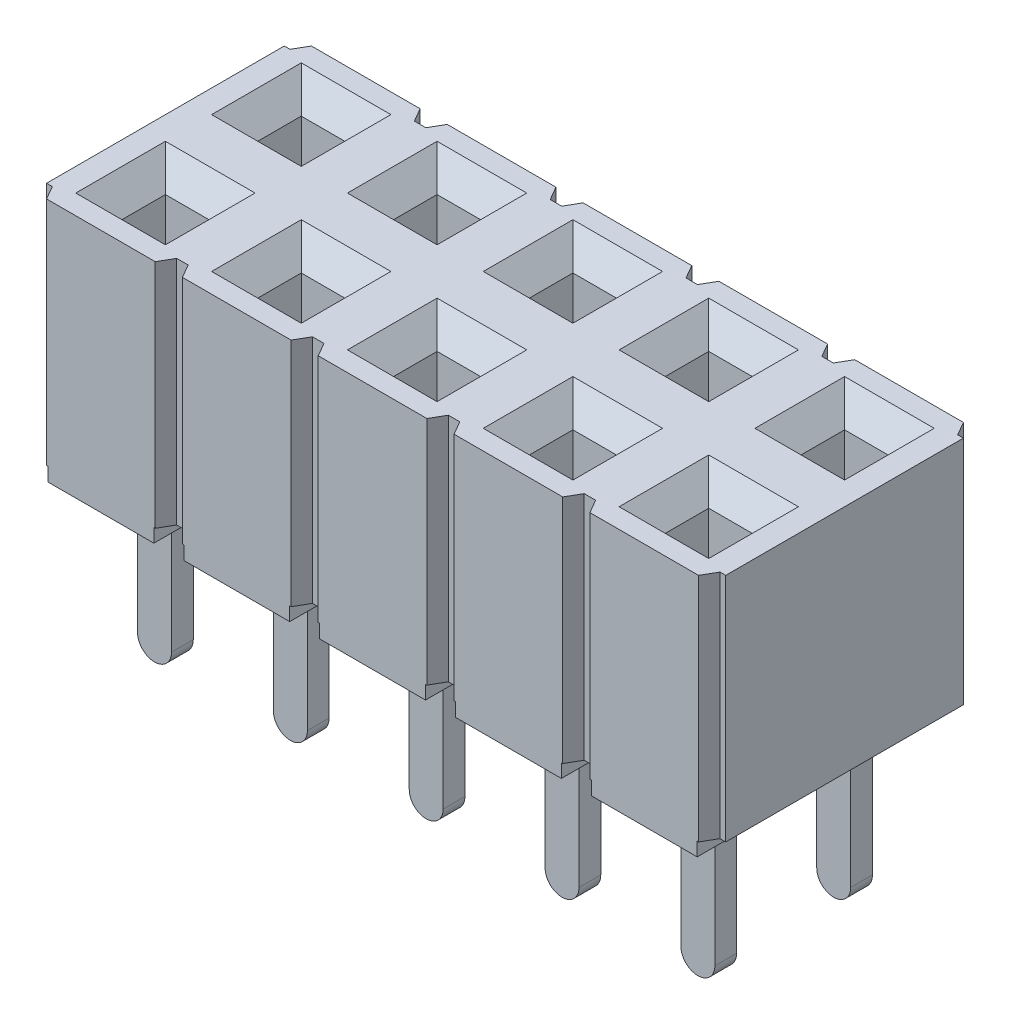
from build123d import *

# Parameters (mm, degrees)
SKETCH1_W                      = 12.7
SKETCH1_H                      = 4.953
BASE_EXTRUDE_DEPTH             = 4.572
SKETCH2_W                      = 3.937
SKETCH2_H                      = 0.254
STANDOFF_WIDTH_DEPTH           = 14.723200656
UPPER_START                    = -5.5245
UPPER_CORE_OUTLINE_W           = 3.3528
UPPER_CORE_OUTLINE_H           = 0.889
UPPER_CORE_DEPTH               = 0.889
LEAD_IN_SIZE                   = 0.3937
LEAD_IN_SIZE2                  = 0.469193389
CORE_PATTERN_COUNT             = 5
CORE_PATTERN_PITCH             = 2.54
CORE_PATTERN_COUNT_DIR2        = 2
CORE_PATTERN_PITCH_DIR2        = 2.54
LEAD_IN_OF_CORE_PATTERN_SIZE2  = 0.469193389
LEAD_IN_OF_CORE_PATTERN_SIZE   = 0.3937
POSITION_CUT_DEPTH             = 9.207236822
SKETCH10_W                     = 0.2794
SKETCH10_H                     = 0.254
STANDOFF_LENGTH_DEPTH          = 10.260555761
STANDOFF_PATTERN_COUNT         = 5
STANDOFF_PATTERN_PITCH         = 2.54
SKETCH11_W                     = 0.635
SKETCH11_H                     = 0.4064
TAIL_DEPTH                     = 3.175
TAIL_FILLETS_R                 = 0.3175
TAIL_PATTERN_COUNT             = 5
TAIL_PATTERN_PITCH             = 2.54
TAIL_PATTERN_COUNT_DIR2        = 2
TAIL_PATTERN_PITCH_DIR2        = 2.54
TAIL_FILLETS_OF_TAIL_PATTERN_R = 0.3175


# Read off the part's stored shape, not the designer's step: Upper Core
with BuildPart() as part:
    # Sketch1 → Base-Extrude (new body)
    with BuildSketch(Plane(origin=(0, 0, 0), x_dir=(1, 0, 0), z_dir=(0, 1, 0))):
        Rectangle(SKETCH1_W, SKETCH1_H)
    extrude(amount=BASE_EXTRUDE_DEPTH)

    # Sketch2 → Standoff - Width (cut, through all)
    with BuildSketch(Plane.ZY.offset(6.35)):
        with Locations((0, 0.127)):
            Rectangle(SKETCH2_W, SKETCH2_H)
    extrude(amount=-STANDOFF_WIDTH_DEPTH, mode=Mode.SUBTRACT)

    # Upper Core outline → Upper Core (cut)
    with BuildSketch(Plane.YZ.offset(UPPER_START)):
        with Locations((2.8956, 1.27)):
            Rectangle(UPPER_CORE_OUTLINE_W, UPPER_CORE_OUTLINE_H)
    upper_core = extrude(amount=UPPER_CORE_DEPTH, mode=Mode.SUBTRACT)

    # Lead-in
    lead_in_edges = [part.edges().sort_by_distance(p)[0] for p in [
        (-5.5245, 4.572, 1.27),
        (-5.08, 4.572, 1.7145),
        (-4.6355, 4.572, 1.27),
        (-5.08, 4.572, 0.8255),
    ]]
    lead_in_side = [part.faces().sort_by_distance(p)[0] for p in [
        (0.064637756, 4.572, -0.016159439),
    ]]
    chamfer(lead_in_edges, length=LEAD_IN_SIZE, length2=LEAD_IN_SIZE2, reference=lead_in_side[0])

    # Core Pattern: Upper Core 5 × 2
    with Locations(*[(i * CORE_PATTERN_PITCH, 0, -j * CORE_PATTERN_PITCH_DIR2) for i in range(CORE_PATTERN_COUNT) for j in range(CORE_PATTERN_COUNT_DIR2) if (i, j) != (0, 0)]):
        add(upper_core, mode=Mode.SUBTRACT)

    # Lead-in of Core Pattern
    lead_in_of_core_pattern_edges = [part.edges().sort_by_distance(p)[0] for p in [
        (-5.5245, 4.572, -1.27),
        (-5.08, 4.572, -0.8255),
        (-4.6355, 4.572, -1.27),
        (-5.08, 4.572, -1.7145),
        (-2.9845, 4.572, 1.27),
        (-2.54, 4.572, 1.7145),
        (-2.0955, 4.572, 1.27),
        (-2.54, 4.572, 0.8255),
        (-2.9845, 4.572, -1.27),
        (-2.54, 4.572, -0.8255),
        (-2.0955, 4.572, -1.27),
        (-2.54, 4.572, -1.7145),
        (-0.4445, 4.572, 1.27),
        (0, 4.572, 1.7145),
        (0.4445, 4.572, 1.27),
        (0, 4.572, 0.8255),
        (-0.4445, 4.572, -1.27),
        (0, 4.572, -0.8255),
        (0.4445, 4.572, -1.27),
        (0, 4.572, -1.7145),
        (2.0955, 4.572, 1.27),
        (2.54, 4.572, 1.7145),
        (2.9845, 4.572, 1.27),
        (2.54, 4.572, 0.8255),
        (2.0955, 4.572, -1.27),
        (2.54, 4.572, -0.8255),
        (2.9845, 4.572, -1.27),
        (2.54, 4.572, -1.7145),
        (4.6355, 4.572, 1.27),
        (5.08, 4.572, 1.7145),
        (5.5245, 4.572, 1.27),
        (5.08, 4.572, 0.8255),
        (4.6355, 4.572, -1.27),
        (5.08, 4.572, -0.8255),
        (5.5245, 4.572, -1.27),
        (5.08, 4.572, -1.7145),
    ]]
    chamfer(lead_in_of_core_pattern_edges, length=LEAD_IN_OF_CORE_PATTERN_SIZE, length2=LEAD_IN_OF_CORE_PATTERN_SIZE2)

    # Sketch4 → Position Cut (cut, through all)
    with BuildSketch(Plane(origin=(0, 4.572, 0), x_dir=(-1, 0, 0), z_dir=(0, 1, 0))):
        Polygon((6.35, 2.2225), (6.242646968, 2.2225), (6.096, 2.4765), (6.35, 2.4765), align=None)
        Polygon((6.096, -2.4765), (6.35, -2.4765), (6.35, -2.2225), (6.242646968, -2.2225), align=None)
        Polygon((3.81, -2.2225), (3.917353032, -2.2225), (4.064, -2.4765), (3.81, -2.4765), align=None)
        Polygon((4.064, 2.4765), (3.81, 2.4765), (3.81, 2.2225), (3.917353032, 2.2225), align=None)
    position_cut = extrude(amount=-POSITION_CUT_DEPTH, mode=Mode.SUBTRACT)

    # Sketch10 → Standoff - Length (cut, through all)
    with BuildSketch(Plane.XY.offset(2.4765)):
        with Locations((-3.9497, 0.127)):
            Rectangle(SKETCH10_W, SKETCH10_H)
        with Locations((-6.2103, 0.127)):
            Rectangle(SKETCH10_W, SKETCH10_H)
    standoff_length = extrude(amount=-STANDOFF_LENGTH_DEPTH, mode=Mode.SUBTRACT)

    # Standoff Pattern: Position Cut, Standoff - Length ×5
    with Locations(*[(i * STANDOFF_PATTERN_PITCH, 0, 0) for i in range(1, STANDOFF_PATTERN_COUNT)]):
        add(position_cut, mode=Mode.SUBTRACT)
        add(standoff_length, mode=Mode.SUBTRACT)

    # Sketch11 → Tail (add)
    with BuildSketch(Plane.XZ.offset(-0.254)):
        with Locations((-5.08, 1.27)):
            Rectangle(SKETCH11_W, SKETCH11_H)
    tail = extrude(amount=TAIL_DEPTH)

    # Tail Fillets
    tail_fillets_edges = [part.edges().sort_by_distance(p)[0] for p in [
        (-5.3975, -2.921, 1.27),
        (-4.7625, -2.921, 1.27),
    ]]
    fillet(tail_fillets_edges, radius=TAIL_FILLETS_R - 0.0001)  # a hair under: the kernel refuses the full size

    # Tail Pattern: Tail 5 × 2
    with Locations(*[(i * TAIL_PATTERN_PITCH, 0, -j * TAIL_PATTERN_PITCH_DIR2) for i in range(TAIL_PATTERN_COUNT) for j in range(TAIL_PATTERN_COUNT_DIR2) if (i, j) != (0, 0)]):
        add(tail)

    # Tail Fillets of Tail Pattern
    tail_fillets_of_tail_pattern_edges = [part.edges().sort_by_distance(p)[0] for p in [
        (-5.3975, -2.921, -1.27),
        (-4.7625, -2.921, -1.27),
        (-2.8575, -2.921, 1.27),
        (-2.2225, -2.921, 1.27),
        (-2.8575, -2.921, -1.27),
        (-2.2225, -2.921, -1.27),
        (-0.3175, -2.921, 1.27),
        (0.3175, -2.921, 1.27),
        (-0.3175, -2.921, -1.27),
        (0.3175, -2.921, -1.27),
        (2.2225, -2.921, 1.27),
        (2.8575, -2.921, 1.27),
        (2.2225, -2.921, -1.27),
        (2.8575, -2.921, -1.27),
        (4.7625, -2.921, 1.27),
        (5.3975, -2.921, 1.27),
        (4.7625, -2.921, -1.27),
        (5.3975, -2.921, -1.27),
    ]]
    fillet(tail_fillets_of_tail_pattern_edges, radius=TAIL_FILLETS_OF_TAIL_PATTERN_R - 0.0001)  # a hair under: the kernel refuses the full size


solid = part.part
